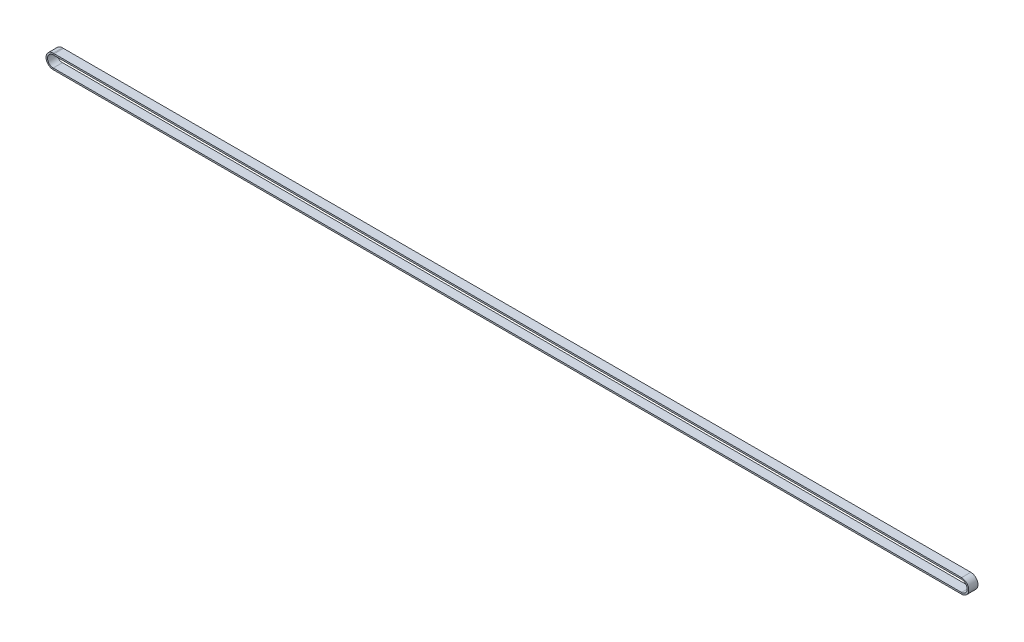
from build123d import *

# Parameters (mm, degrees)
SKETCH3_W = 9
SKETCH3_H = 1.5


with BuildPart() as part:
    # Sweep1: sweep along a path in Sketch2
    with BuildLine(Plane.XY) as sweep1_path:
        Line((-0.999988255, -154.401573189), (883.520314204, -154.401573189))
        ThreePointArc((883.520314204, -154.401573189), (890.52031416, -161.401573233), (883.520314115, -168.401573189))
        Line((883.520314115, -168.401573189), (-0.999988344, -168.401573189))
        ThreePointArc((-0.999988344, -168.401573189), (-7.999988299, -161.401573144), (-0.999988255, -154.401573189))
    # Sketch3 → Sweep1 (sweep)
    with BuildSketch(Plane(origin=(0, 0, 0), x_dir=(0, 0, -1), z_dir=(1, 0, 0))):
        with Locations((-4.5, -155.151573189)):
            Rectangle(SKETCH3_W, SKETCH3_H)
    sweep(path=sweep1_path.line)


solid = part.part
